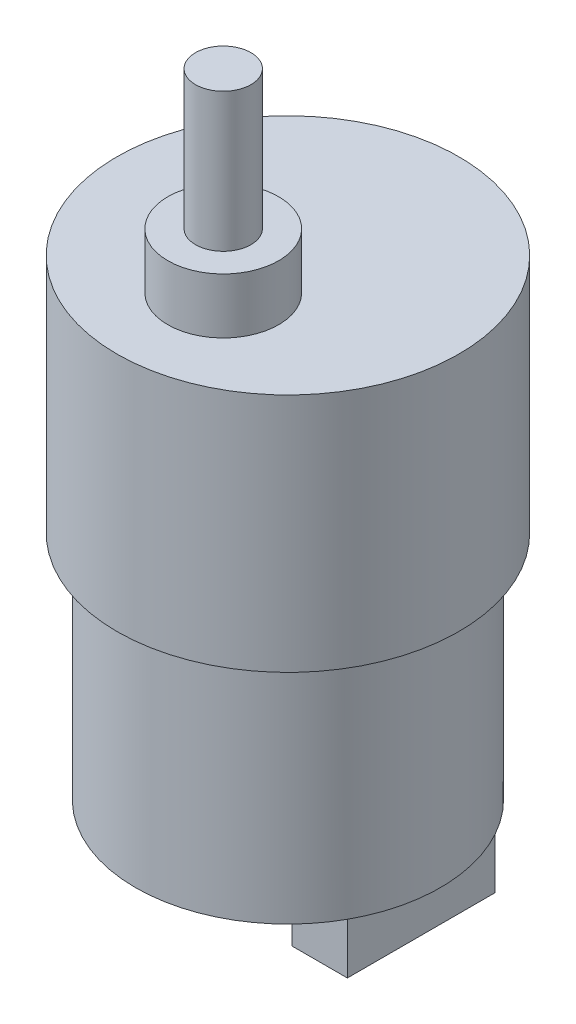
from build123d import *

# Parameters (mm, degrees)
SKETCH1_R           = 18.5
SKETCH1_R_2         = 16.5
SKETCH1_R_3         = 6
SKETCH1_R_4         = 4.5
SKETCH1_W           = 6
SKETCH1_H           = 16
SKETCH1_R_5         = 3
BOSS_EXTRUDE1_DEPTH = 26
BOSS_EXTRUDE2_START = -26
SKETCH1_3_R         = 16.5
BOSS_EXTRUDE2_DEPTH = 25
BOSS_EXTRUDE3_START = -56.5
SKETCH1_4_W         = 6
SKETCH1_4_H         = 16
BOSS_EXTRUDE3_DEPTH = 5.5
BOSS_EXTRUDE4_START = -51
SKETCH1_5_R         = 4.5
BOSS_EXTRUDE4_DEPTH = 8.5
SKETCH1_6_R         = 6
BOSS_EXTRUDE5_DEPTH = 6
BOSS_EXTRUDE6_START = 6
SKETCH1_7_R         = 3
BOSS_EXTRUDE6_DEPTH = 15


with BuildPart() as part:
    # Sketch1 → Boss-Extrude1 (new body)
    # profile 1 of 14: a face of its own
    with BuildSketch(Plane(origin=(0, 0, 0), x_dir=(1, 0, 0), z_dir=(0, 1, 0))):
        with Locations(Location((0, 0, 0), (0, 0, 270))):
            Circle(SKETCH1_R)
        Circle(SKETCH1_R_2, mode=Mode.SUBTRACT)
    # profile 2 of 14: a face of its own
    with BuildSketch(Plane(origin=(0, 0, 0), x_dir=(1, 0, 0), z_dir=(0, 1, 0))):
        with BuildLine():
            Line((14.43086969, -8), (8.43086969, -8))
            Line((8.43086969, -8), (8.43086969, 8))
            Line((8.43086969, 8), (14.43086969, 8))
            ThreePointArc((14.43086969, 8), (-16.5, 0), (14.43086969, -8))
        make_face()
        with BuildLine():
            ThreePointArc((3.822221213, -2.375), (5.428320517, -4.443960806), (6, -7))
            ThreePointArc((6, -7), (-2.556039194, -12.428320517), (-3.822221213, -2.375))
            ThreePointArc((-3.822221213, -2.375), (-1.234909823, 4.327239042), (4.5, 0))
            ThreePointArc((4.5, 0), (4.327239042, -1.234909823), (3.822221213, -2.375))
        make_face(mode=Mode.SUBTRACT)
    # profile 3 of 14: a face of its own
    with BuildSketch(Plane(origin=(0, 0, 0), x_dir=(1, 0, 0), z_dir=(0, 1, 0))):
        with Locations((0, -7)):
            Circle(SKETCH1_R_3)
    # profile 4 of 14: a face of its own
    with BuildSketch(Plane(origin=(0, 0, 0), x_dir=(1, 0, 0), z_dir=(0, 1, 0))):
        Circle(SKETCH1_R_4)
    # profile 5 of 14: a face of its own
    with BuildSketch(Plane(origin=(0, 0, 0), x_dir=(1, 0, 0), z_dir=(0, 1, 0))):
        with Locations((11.43086969, 0)):
            Rectangle(SKETCH1_W, SKETCH1_H)
    # profile 6 of 14: a face of its own
    with BuildSketch(Plane(origin=(0, 0, 0), x_dir=(1, 0, 0), z_dir=(0, 1, 0))):
        with BuildLine():
            Line((14.43086969, 8), (14.43086969, -8))
            ThreePointArc((14.43086969, -8), (15.974344273, -4.13162499), (16.5, 0))
            ThreePointArc((16.5, 0), (15.974344273, 4.13162499), (14.43086969, 8))
        make_face()
    # profile 7 of 14: a face of its own
    with BuildSketch(Plane(origin=(0, 0, 0), x_dir=(1, 0, 0), z_dir=(0, 1, 0))):
        Circle(SKETCH1_R_4)
    # profile 8 of 14: a face of its own
    with BuildSketch(Plane(origin=(0, 0, 0), x_dir=(1, 0, 0), z_dir=(0, 1, 0))):
        with Locations((0, -7)):
            Circle(SKETCH1_R_3)
        with Locations((0, -7)):
            Circle(SKETCH1_R_5, mode=Mode.SUBTRACT)
    # profile 9 of 14: a face of its own
    with BuildSketch(Plane(origin=(0, 0, 0), x_dir=(1, 0, 0), z_dir=(0, 1, 0))):
        Circle(SKETCH1_R_4)
    # profile 10 of 14: a face of its own
    with BuildSketch(Plane(origin=(0, 0, 0), x_dir=(1, 0, 0), z_dir=(0, 1, 0))):
        Circle(SKETCH1_R_4)
    # profile 11 of 14: a face of its own
    with BuildSketch(Plane(origin=(0, 0, 0), x_dir=(1, 0, 0), z_dir=(0, 1, 0))):
        with Locations((0, -7)):
            Circle(SKETCH1_R_3)
        with Locations((0, -7)):
            Circle(SKETCH1_R_5, mode=Mode.SUBTRACT)
    # profile 12 of 14: a face of its own
    with BuildSketch(Plane(origin=(0, 0, 0), x_dir=(1, 0, 0), z_dir=(0, 1, 0))):
        with Locations((0, -7)):
            Circle(SKETCH1_R_5)
    # profile 13 of 14: a face of its own
    with BuildSketch(Plane(origin=(0, 0, 0), x_dir=(1, 0, 0), z_dir=(0, 1, 0))):
        with Locations((0, -7)):
            Circle(SKETCH1_R_5)
    # profile 14 of 14: a face of its own
    with BuildSketch(Plane(origin=(0, 0, 0), x_dir=(1, 0, 0), z_dir=(0, 1, 0))):
        Circle(SKETCH1_R_4)
    extrude(amount=-BOSS_EXTRUDE1_DEPTH)

    # Sketch1<3> → Boss-Extrude2 (add)
    with BuildSketch(Plane(origin=(0, 0, 0), x_dir=(1, 0, 0), z_dir=(0, 1, 0)).offset(BOSS_EXTRUDE2_START)):
        with Locations(Location((0, 0, 0), (0, 0, 270))):
            Circle(SKETCH1_3_R)
    extrude(amount=-BOSS_EXTRUDE2_DEPTH)

    # Sketch1<4> → Boss-Extrude3 (add)
    with BuildSketch(Plane(origin=(0, 0, 0), x_dir=(1, 0, 0), z_dir=(0, 1, 0)).offset(BOSS_EXTRUDE3_START)):
        with Locations((11.43086969, 0)):
            Rectangle(SKETCH1_4_W, SKETCH1_4_H)
    extrude(amount=BOSS_EXTRUDE3_DEPTH)

    # Sketch1<5> → Boss-Extrude4 (add)
    with BuildSketch(Plane(origin=(0, 0, 0), x_dir=(1, 0, 0), z_dir=(0, 1, 0)).offset(BOSS_EXTRUDE4_START)):
        with Locations(Location((0, 0, 0), (0, 0, 270))):
            Circle(SKETCH1_5_R)
    extrude(amount=-BOSS_EXTRUDE4_DEPTH)

    # Sketch1<6> → Boss-Extrude5 (add)
    with BuildSketch(Plane(origin=(0, 0, 0), x_dir=(1, 0, 0), z_dir=(0, 1, 0))):
        with Locations(Location((0, -7, 0), (0, 0, 270))):
            Circle(SKETCH1_6_R)
    extrude(amount=BOSS_EXTRUDE5_DEPTH)

    # Sketch1<7> → Boss-Extrude6 (add)
    with BuildSketch(Plane(origin=(0, 0, 0), x_dir=(1, 0, 0), z_dir=(0, 1, 0)).offset(BOSS_EXTRUDE6_START)):
        with Locations(Location((0, -7, 0), (0, 0, 270))):
            Circle(SKETCH1_7_R)
    extrude(amount=BOSS_EXTRUDE6_DEPTH)


solid = part.part
